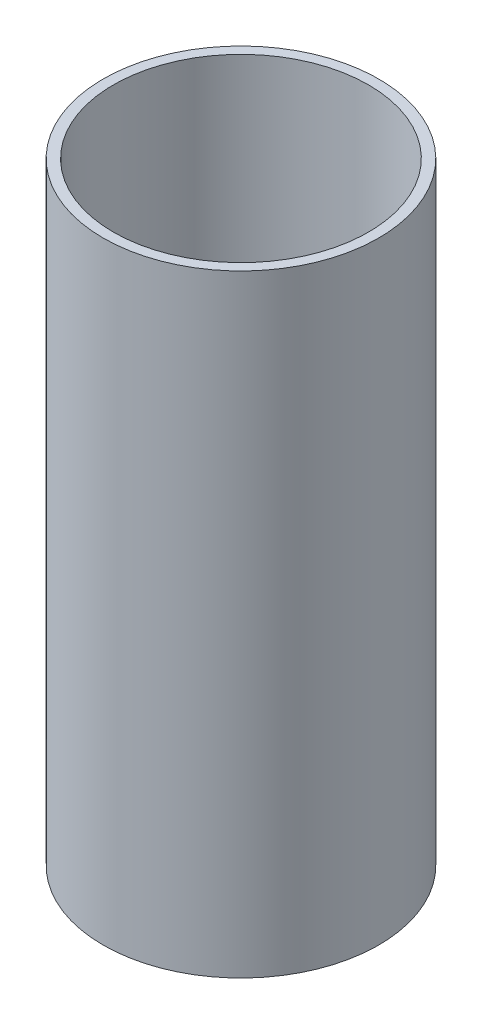
from build123d import *

# Parameters (mm, degrees)
ESBO_O1_R                = 27
ESBO_O1_R_2              = 25
RESSALTO_EXTRUS_O1_DEPTH = 120


with BuildPart() as part:
    # Esboço1 → Ressalto-extrusão1 (new body)
    with BuildSketch(Plane(origin=(0, 0, 0), x_dir=(1, 0, 0), z_dir=(0, 1, 0))):
        Circle(ESBO_O1_R)
        Circle(ESBO_O1_R_2, mode=Mode.SUBTRACT)
    extrude(amount=RESSALTO_EXTRUS_O1_DEPTH)


solid = part.part
